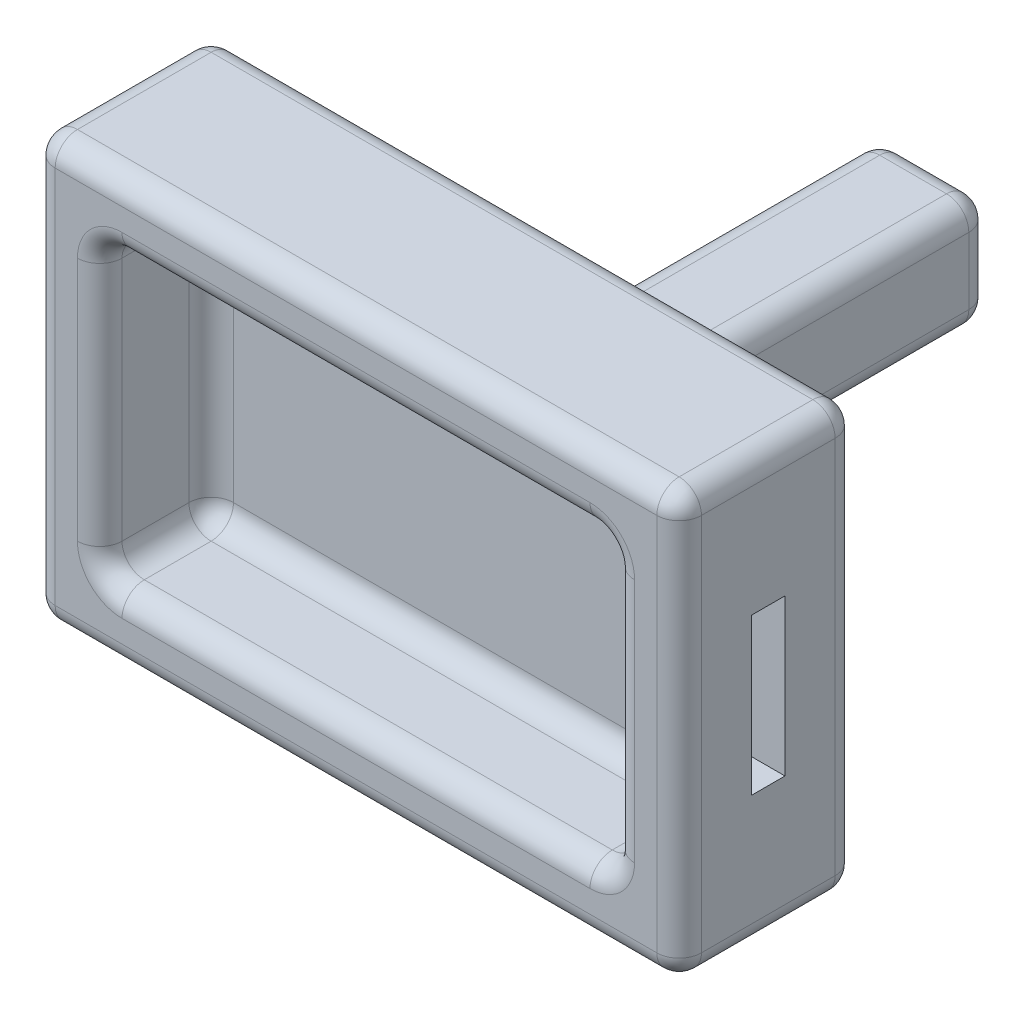
from build123d import *

# Parameters (mm, degrees)
SKETCH1_W           = 29
SKETCH1_H           = 19
BOSS_EXTRUDE1_DEPTH = 3
SKETCH2_W           = 29
SKETCH2_H           = 19
SKETCH2_W_2         = 23
SKETCH2_H_2         = 13
BOSS_EXTRUDE2_DEPTH = 5
SKETCH3_W           = 5
SKETCH3_H           = 5
BOSS_EXTRUDE3_DEPTH = 18
FILLET1_R           = 1
SKETCH4_W           = 1.5
SKETCH4_H           = 7
CUT_EXTRUDE1_DEPTH  = 8


with BuildPart() as part:
    # Sketch1 → Boss-Extrude1 (new body)
    with BuildSketch(Plane.XY):
        Rectangle(SKETCH1_W, SKETCH1_H)
    extrude(amount=BOSS_EXTRUDE1_DEPTH)

    # Sketch2 → Boss-Extrude2 (add)
    with BuildSketch(Plane.XY.offset(3)):
        Rectangle(SKETCH2_W, SKETCH2_H)
        Rectangle(SKETCH2_W_2, SKETCH2_H_2, mode=Mode.SUBTRACT)
    extrude(amount=BOSS_EXTRUDE2_DEPTH)

    # Sketch3 → Boss-Extrude3 (add)
    with BuildSketch(Plane(origin=(0, 0, 0), x_dir=(-1, 0, 0), z_dir=(0, 0, -1))):
        Rectangle(SKETCH3_W, SKETCH3_H)
    extrude(amount=BOSS_EXTRUDE3_DEPTH)

    # Fillet1
    fillet1_edges = [part.edges().sort_by_distance(p)[0] for p in [
        (-14.5, -9.5, 4),
        (-14.5, 0, 8),
        (-14.5, 9.5, 4),
        (-11.5, 0, 3),
        (0, -6.5, 3),
        (11.5, 0, 3),
        (0, 6.5, 3),
        (-11.5, 0, 8),
        (0, -6.5, 8),
        (11.5, 0, 8),
        (0, 6.5, 8),
        (-11.5, 6.5, 5.5),
        (11.5, -6.5, 5.5),
        (-11.5, -6.5, 5.5),
        (0, -9.5, 8),
        (14.5, 0, 8),
        (14.5, 0, 0),
        (0, 9.5, 0),
        (14.5, -9.5, 4),
        (14.5, 9.5, 4),
        (0, 9.5, 8),
        (-14.5, 0, 0),
        (0, -9.5, 0),
        (11.5, 6.5, 5.5),
        (2.5, 0, -18),
        (2.5, 0, 0),
        (2.5, -2.5, -9),
        (0, -2.5, -18),
        (0, -2.5, 0),
        (0, 2.5, -18),
        (2.5, 2.5, -9),
        (0, 2.5, 0),
        (-2.5, -2.5, -9),
        (-2.5, 0, -18),
        (-2.5, 2.5, -9),
        (-2.5, 0, 0),
    ]]
    fillet(fillet1_edges, radius=FILLET1_R)

    # Sketch4 → Cut-Extrude1 (cut)
    with BuildSketch(Plane(origin=(14.5, 0, 0), x_dir=(0, 0, -1), z_dir=(1, 0, 0))):
        with Locations((-4, 0)):
            Rectangle(SKETCH4_W, SKETCH4_H)
    extrude(amount=-CUT_EXTRUDE1_DEPTH, mode=Mode.SUBTRACT)


solid = part.part
